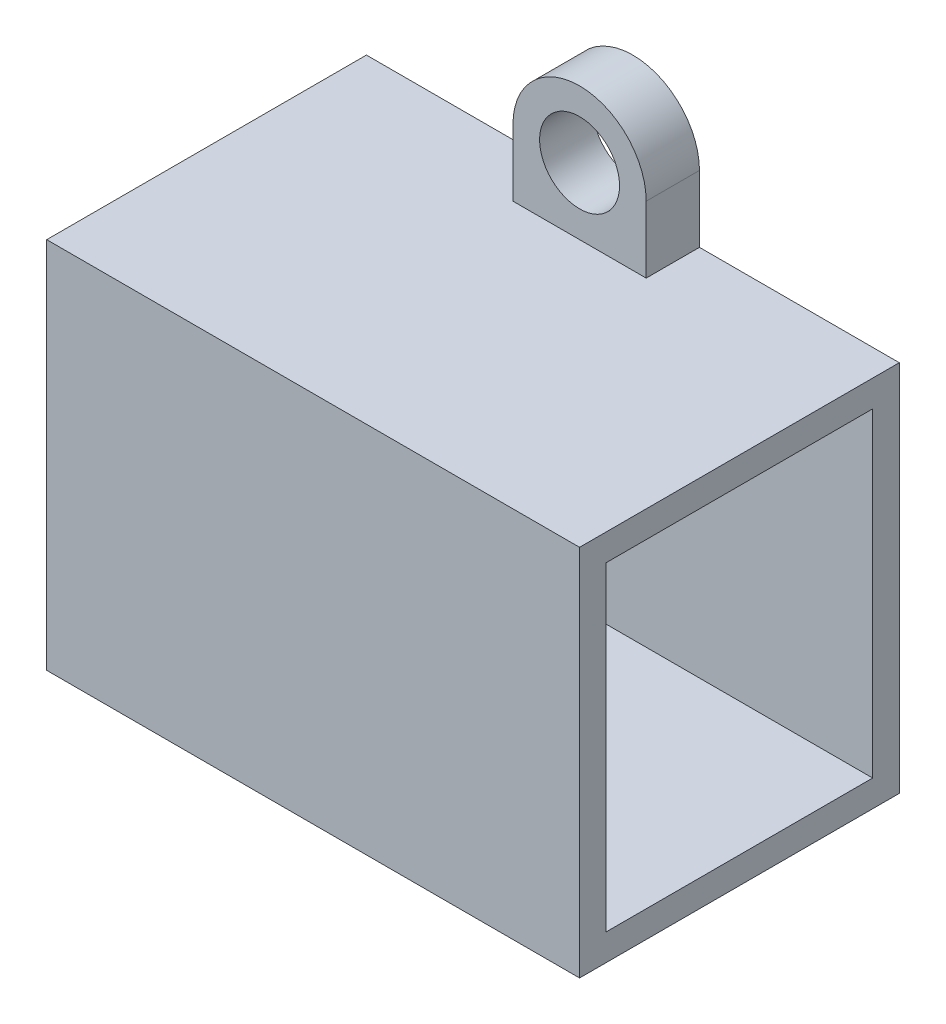
from build123d import *

# Parameters (mm, degrees)
SKETCH1_W           = 20
SKETCH1_H           = 14
BOSS_EXTRUDE1_DEPTH = 12
SKETCH2_R           = 1.5
BOSS_EXTRUDE2_DEPTH = 2
SHELL2_START        = -6
SHELL2_OUTLINE_W    = 20
SHELL2_OUTLINE_H    = 10
SHELL2_DEPTH        = 12


# Read off the part's stored shape, not the designer's step: Shell2
with BuildPart() as part:
    # Sketch1 → Boss-Extrude1 (new body)
    with BuildSketch(Plane.XY):
        Rectangle(SKETCH1_W, SKETCH1_H)
    extrude(amount=BOSS_EXTRUDE1_DEPTH)

    # Sketch2 → Boss-Extrude2 (add)
    # profile 1 of 2: a face of its own
    with BuildSketch(Plane.XY):
        with BuildLine():
            Line((2.5, -9.5), (2.5, -7))
            Line((2.5, -7), (-2.5, -7))
            Line((-2.5, -7), (-2.5, -9.5))
            ThreePointArc((-2.5, -9.5), (0, -12), (2.5, -9.5))
        make_face()
        with Locations((0, -9.5)):
            Circle(SKETCH2_R, mode=Mode.SUBTRACT)
    # profile 2 of 2: a face of its own
    with BuildSketch(Plane.XY):
        with BuildLine():
            Line((2.5, 9.5), (2.5, 7))
            Line((2.5, 7), (-2.5, 7))
            Line((-2.5, 7), (-2.5, 9.5))
            ThreePointArc((-2.5, 9.5), (0, 12), (2.5, 9.5))
        make_face()
        with Locations((0, 9.5)):
            Circle(SKETCH2_R, mode=Mode.SUBTRACT)
    extrude(amount=BOSS_EXTRUDE2_DEPTH)

    # Shell2 outline → Shell2 (cut)
    with BuildSketch(Plane(origin=(0, 0, 0), x_dir=(1, 0, 0), z_dir=(0, 1, 0)).offset(SHELL2_START)):
        with Locations((0, -6)):
            Rectangle(SHELL2_OUTLINE_W, SHELL2_OUTLINE_H)
    extrude(amount=SHELL2_DEPTH, mode=Mode.SUBTRACT)


solid = part.part
